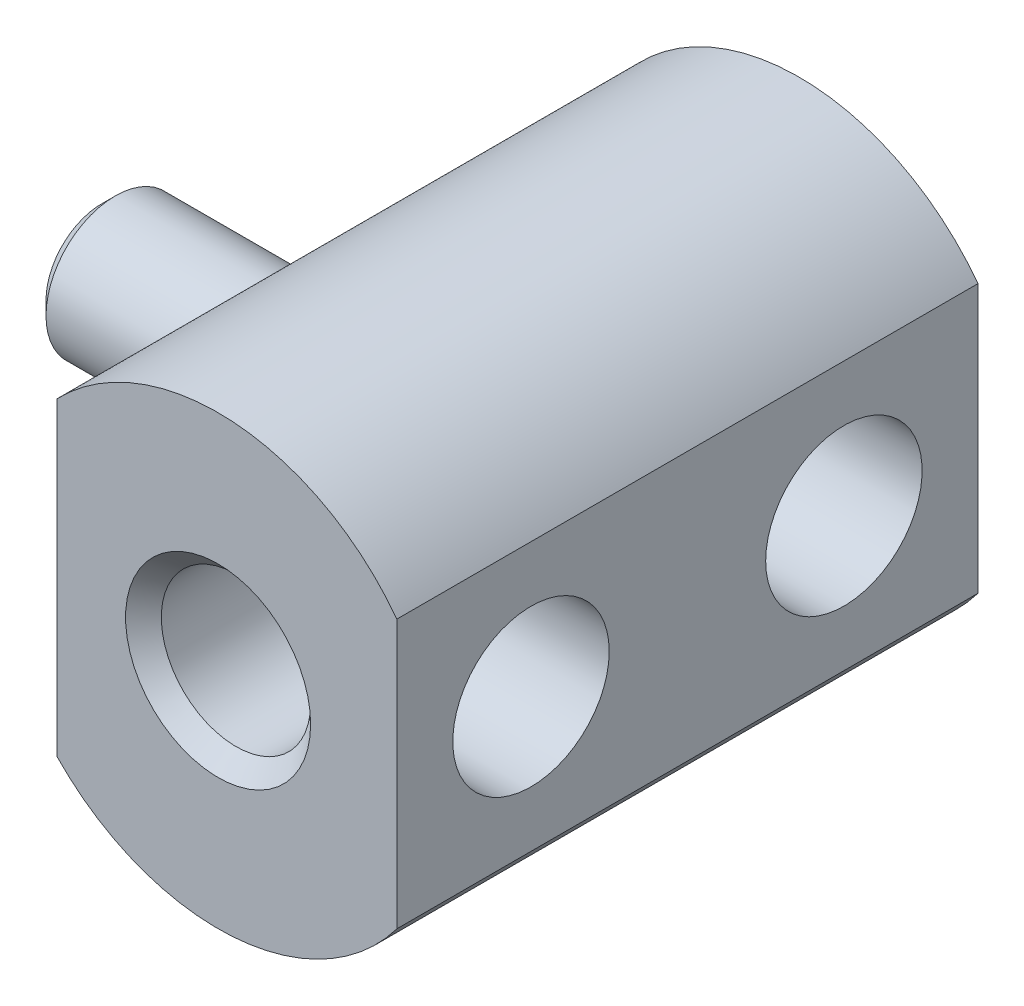
from build123d import *

# Parameters (mm, degrees)
SKETCH1_R           = 6.35
SKETCH1_R_2         = 2.1209
BOSS_EXTRUDE1_DEPTH = 8.255
CUT_EXTRUDE1_DEPTH  = 19.794283705
SKETCH4_R           = 1.9685
BOSS_EXTRUDE2_DEPTH = 6.985
FILLET1_R           = 1.27
CHAMFER1_SIZE       = 0.381
SKETCH5_R           = 2.2225
CUT_EXTRUDE2_DEPTH  = 4.445
CHAMFER2_SIZE       = 0.508


with BuildPart() as part:
    # Sketch1 → Boss-Extrude1 (new, symmetric)
    with BuildSketch(Plane.XY):
        Circle(SKETCH1_R)
        Circle(SKETCH1_R_2, mode=Mode.SUBTRACT)
    extrude(amount=BOSS_EXTRUDE1_DEPTH, both=True)

    # Sketch3 → Cut-Extrude1 (cut, through all)
    with BuildSketch(Plane.XY.offset(8.255)):
        with BuildLine():
            Line((-4.572, 4.4067353), (-4.572, -4.4067353))
            ThreePointArc((-4.572, -4.4067353), (-6.35, 0), (-4.572, 4.4067353))
        make_face()
        with BuildLine():
            Line((5.08, 3.81), (5.08, -3.81))
            ThreePointArc((5.08, -3.81), (6.35, 0), (5.08, 3.81))
        make_face()
    extrude(amount=-CUT_EXTRUDE1_DEPTH, mode=Mode.SUBTRACT)

    # Sketch4 → Boss-Extrude2 (add)
    with BuildSketch(Plane.ZY.offset(4.572)):
        Circle(SKETCH4_R)
    extrude(amount=BOSS_EXTRUDE2_DEPTH)

    # Fillet1
    fillet1_edges = [part.edges().sort_by_distance(p)[0] for p in [
        (-4.572, 0, -1.9685),
    ]]
    fillet(fillet1_edges, radius=FILLET1_R)

    # Chamfer1
    chamfer1_edges = [part.edges().sort_by_distance(p)[0] for p in [
        (-11.557, 0, -1.9685),
    ]]
    chamfer(chamfer1_edges, length=CHAMFER1_SIZE)

    # Sketch5 → Cut-Extrude2 (cut)
    with BuildSketch(Plane(origin=(5.08, 0, 0), x_dir=(0, 0, -1), z_dir=(1, 0, 0))):
        with Locations((-4.445, 0)):
            Circle(SKETCH5_R)
        with Locations((4.445, 0)):
            Circle(SKETCH5_R)
    extrude(amount=-CUT_EXTRUDE2_DEPTH, mode=Mode.SUBTRACT)

    # Chamfer2
    chamfer2_edges = [part.edges().sort_by_distance(p)[0] for p in [
        (-2.1209, 0, -8.255),
        (-2.1209, 0, 8.255),
    ]]
    chamfer(chamfer2_edges, length=CHAMFER2_SIZE)


solid = part.part
